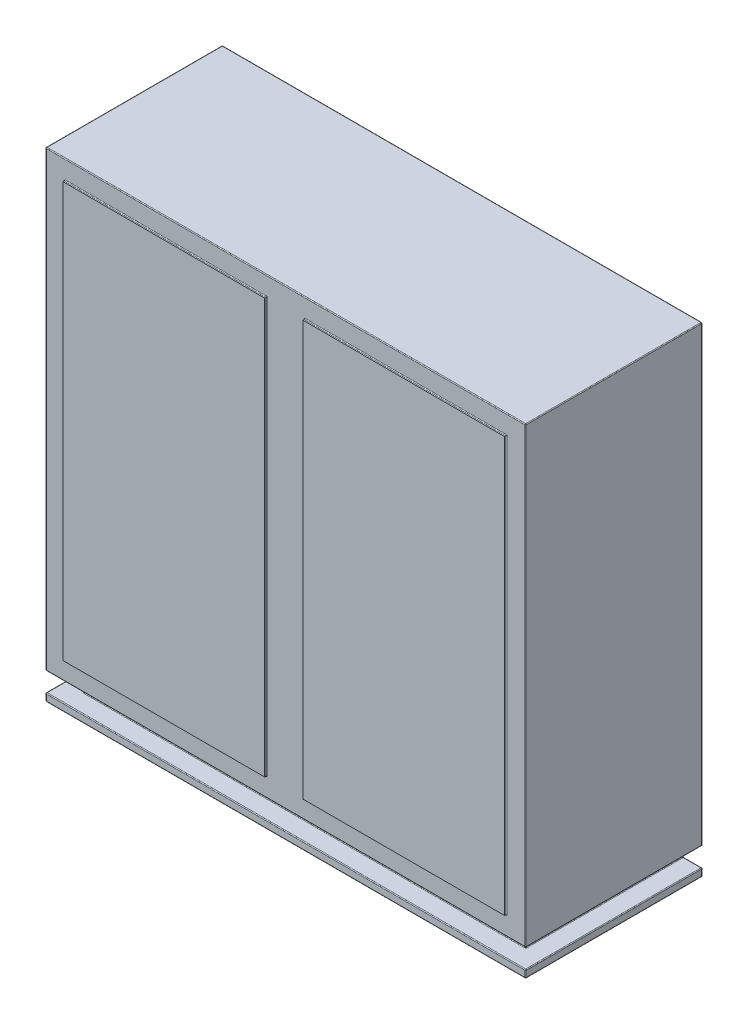
from build123d import *

# Parameters (mm, degrees)
BOSS_EXTRU_1_DEPTH      = 625
ESQUISSE4_W             = 50
ESQUISSE4_H             = 50
ENL_V_MAT_EXTRU_1_DEPTH = 1472.300445184
ESQUISSE5_W             = 525
ESQUISSE5_H             = 1080
BOSS_EXTRU_2_DEPTH      = 5
CONG_1_R                = 2


with BuildPart() as part:
    # Esquisse1 → Boss.-Extru.1 (new, symmetric)
    with BuildSketch(Plane(origin=(0, 0, 0), x_dir=(0, 0, -1), z_dir=(1, 0, 0))):
        Polygon((-230, 0), (230, 0), (230, 1250), (-230, 1250), (-230, 70), (-180, 70), (-180, 20), (-230, 20), align=None)
    extrude(amount=BOSS_EXTRU_1_DEPTH, both=True)

    # Esquisse4 → Enlèv. mat.-Extru.1 (cut, through all)
    with BuildSketch(Plane.XY.offset(230)):
        with Locations((-600, 45)):
            Rectangle(ESQUISSE4_W, ESQUISSE4_H)
        with Locations((600, 45)):
            Rectangle(ESQUISSE4_W, ESQUISSE4_H)
    extrude(amount=-ENL_V_MAT_EXTRU_1_DEPTH, mode=Mode.SUBTRACT)

    # Esquisse5 → Boss.-Extru.2 (add)
    with BuildSketch(Plane.XY.offset(230)):
        with Locations((-312.5, 660)):
            Rectangle(ESQUISSE5_W, ESQUISSE5_H)
        with Locations((312.5, 660)):
            Rectangle(ESQUISSE5_W, ESQUISSE5_H)
    extrude(amount=BOSS_EXTRU_2_DEPTH)

    # Congé1
    cong_1_edges = [part.edges().sort_by_distance(p)[0] for p in [
        (625, 10, 230),
        (-625, 10, 230),
        (0, 0, 230),
        (625, 0, 0),
        (-625, 0, 0),
        (-575, 45, 180),
        (575, 45, 180),
        (-575, 20, -25),
        (0, 20, 180),
        (575, 20, -25),
        (625, 20, 0),
        (0, 20, 230),
        (-625, 20, 0),
        (-575, 70, -25),
        (575, 70, -25),
        (0, 70, 180),
        (312.5, 120, 230),
        (575, 660, 230),
        (312.5, 1200, 230),
        (50, 660, 230),
        (0, 70, 230),
        (-312.5, 120, 230),
        (-50, 660, 230),
        (-312.5, 1200, 230),
        (-575, 660, 230),
        (600, 70, -230),
        (-600, 70, -230),
        (-575, 45, -230),
        (-600, 20, -230),
        (-625, 10, -230),
        (0, 0, -230),
        (625, 10, -230),
        (600, 20, -230),
        (575, 45, -230),
        (-625, 660, 230),
        (-625, 70, 0),
        (-625, 660, -230),
        (625, 660, 230),
        (625, 660, -230),
        (625, 70, 0),
        (0, 1250, -230),
        (625, 1250, 0),
        (0, 1250, 230),
        (-625, 1250, 0),
    ]]
    fillet(cong_1_edges, radius=CONG_1_R)


solid = part.part
